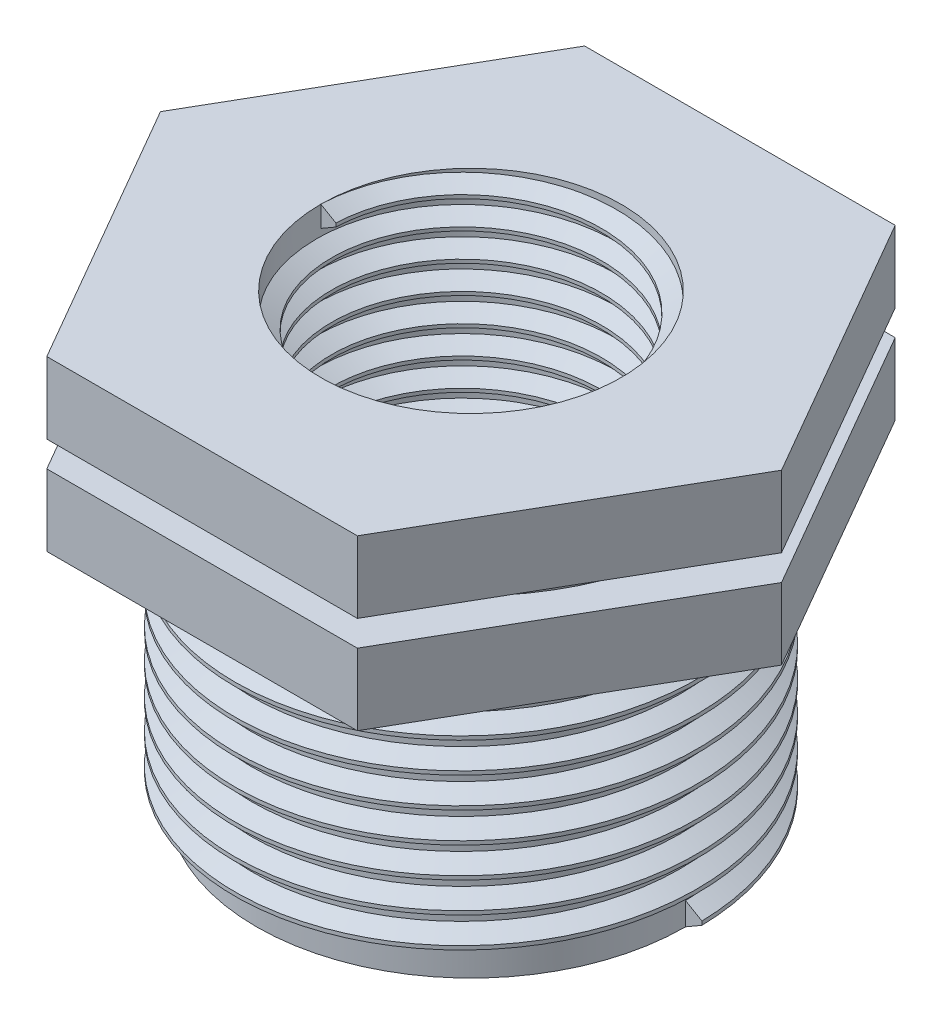
from build123d import *
from build123d.topology import SkipClean

# Parameters (mm, degrees)
SZKIC1_R                    = 15
SZKIC1_R_2                  = 11.5
DODANIE_WYCI_GNI_CIE1_DEPTH = 19.2
SZKIC2_R                    = 11.5
DODANIE_WYCI_GNI_CIE2_DEPTH = 11.8
DODANIE_WYCI_GNI_CIE3_START = -17
SZKIC3_R                    = 11.5
SZKIC3_R_2                  = 10.5
DODANIE_WYCI_GNI_CIE3_DEPTH = 17
DODANIE_WYCI_GNI_CIE5_START = 3
SZKIC4_R                    = 11.5
SZKIC4_R_2                  = 8.6
DODANIE_WYCI_GNI_CIE5_DEPTH = 3
WYTNIJ_WYCI_GNI_CIE1_START  = -5
SZKIC5_R                    = 16.5
WYTNIJ_WYCI_GNI_CIE1_DEPTH  = 1.8
GWINT1_PITCH                = 2.116666667
GWINT2_PITCH                = 1.953846154


with BuildPart() as part:
    # Szkic1 → Dodanie-wyciągnięcie1 (new body)
    with BuildSketch(Plane(origin=(0, 0, 0), x_dir=(1, 0, 0), z_dir=(0, 1, 0))):
        with Locations(Location((0, 0, 0), (0, 0, 270))):
            Circle(SZKIC1_R)
        with Locations(Location((0, 0, 0), (0, 0, 270))):
            Circle(SZKIC1_R_2, mode=Mode.SUBTRACT)
    extrude(amount=DODANIE_WYCI_GNI_CIE1_DEPTH)

    # Szkic2 → Dodanie-wyciągnięcie2 (add)
    with BuildSketch(Plane(origin=(0, 19.2, 0), x_dir=(1, 0, 0), z_dir=(0, 1, 0))):
        Polygon((21.708370122, 0), (10.854185061, 18.8), (-10.854185061, 18.8), (-21.708370122, 0), (-10.854185061, -18.8), (10.854185061, -18.8), align=None)
        with Locations(Location((0, 0, 0), (0, 0, 270))):
            Circle(SZKIC2_R, mode=Mode.SUBTRACT)
    extrude(amount=DODANIE_WYCI_GNI_CIE2_DEPTH)

    # Szkic3 → Dodanie-wyciągnięcie3 (add)
    with BuildSketch(Plane(origin=(0, 31, 0), x_dir=(1, 0, 0), z_dir=(0, 1, 0)).offset(DODANIE_WYCI_GNI_CIE3_START)):
        with Locations(Location((0, 0, 0), (0, 0, 270))):
            Circle(SZKIC3_R)
        with Locations(Location((0, 0, 0), (0, 0, 270))):
            Circle(SZKIC3_R_2, mode=Mode.SUBTRACT)
    extrude(amount=DODANIE_WYCI_GNI_CIE3_DEPTH)

    # Szkic4 → Dodanie-wyciągnięcie5 (add)
    with BuildSketch(Plane.XZ.offset(-14).offset(DODANIE_WYCI_GNI_CIE5_START)):
        with Locations(Location((0, 0, 0), (0, 0, 270))):
            Circle(SZKIC4_R)
        with Locations(Location((0, 0, 0), (0, 0, 270))):
            Circle(SZKIC4_R_2, mode=Mode.SUBTRACT)
    extrude(amount=-DODANIE_WYCI_GNI_CIE5_DEPTH)

    # Szkic5 → Wytnij-wyciągnięcie1 (cut)
    with BuildSketch(Plane(origin=(0, 31, 0), x_dir=(1, 0, 0), z_dir=(0, 1, 0)).offset(WYTNIJ_WYCI_GNI_CIE1_START)):
        Polygon((-10.854185061, -18.8), (10.854185061, -18.8), (21.708370122, 0), (10.854185061, 18.8), (-10.854185061, 18.8), (-21.708370122, 0), align=None)
        with Locations(Location((0, 0, 0), (0, 0, 270))):
            Circle(SZKIC5_R, mode=Mode.SUBTRACT)
    extrude(amount=-WYTNIJ_WYCI_GNI_CIE1_DEPTH, mode=Mode.SUBTRACT)

    # Gwint1: the profile of Profil gwintu1 profile screwed along a right-hand helix of 9.070866 turns, 10 arcs to a turn; built about Z, then put on its axis
    with SkipClean():  # the faces are left unmerged after this step: merging them gives an invalid solid
        gwint1_z = Axis((0, 0, 0), (0, 0, 1))
        gwint1_corners = [(14.9997, 0, -0.000173205), (16.145679435, 0, 0.66145833), (16.145679435, 0, 0.926041664), (14.9997, 0, 1.587673199)]
        with BuildLine(mode=Mode.PRIVATE) as gwint1_profile:
            Line(gwint1_corners[0], gwint1_corners[1])
            Line(gwint1_corners[1], gwint1_corners[2])
            Line(gwint1_corners[2], gwint1_corners[3])
            Line(gwint1_corners[3], gwint1_corners[0])
        gwint1_cap = Face(gwint1_profile.wire())
        gwint1_turn_angles = [0, 18, 36, 54, 72, 90, 108, 126, 144, 162, 180, 198, 216, 234, 252, 270, 288, 306, 324, 342, 360]
        gwint1_turn_weights = [1, 0.9510565162951535, 1, 0.9510565162951535, 1, 0.9510565162951535, 1, 0.9510565162951535, 1, 0.9510565162951535, 1, 0.9510565162951535, 1, 0.9510565162951535, 1, 0.9510565162951535, 1, 0.9510565162951535, 1, 0.9510565162951535, 1]
        gwint1_turn_rails = [Edge.make_bspline([Vector(p[0], p[1], 0).rotate(gwint1_z, gwint1_turn_angles[k]) / gwint1_turn_weights[k] + Vector(0, 0, p[2] + GWINT1_PITCH * gwint1_turn_angles[k] / 360) for k in range(21)], [0, 0, 0, 1, 1, 2, 2, 3, 3, 4, 4, 5, 5, 6, 6, 7, 7, 8, 8, 9, 9, 10, 10, 10], 2, gwint1_turn_weights) for p in gwint1_corners]
        gwint1_turn_sides = [Face.make_surface_from_curves(gwint1_turn_rails[p[0]], gwint1_turn_rails[p[1]]) for p in [(0, 1), (1, 2), (2, 3), (3, 0)]]
        gwint1_last_angles = [3240, 3252.755905512, 3265.511811024]
        gwint1_last_weights = [1, 0.9753195679051615, 1]
        gwint1_last_rails = [Edge.make_bspline([Vector(p[0], p[1], 0).rotate(gwint1_z, gwint1_last_angles[k]) / gwint1_last_weights[k] + Vector(0, 0, p[2] + GWINT1_PITCH * gwint1_last_angles[k] / 360) for k in range(3)], [0, 0, 0, 1, 1, 1], 2, gwint1_last_weights) for p in gwint1_corners]
        gwint1_last_sides = [Face.make_surface_from_curves(gwint1_last_rails[p[0]], gwint1_last_rails[p[1]]) for p in [(0, 1), (1, 2), (2, 3), (3, 0)]]
        gwint1 = Plane(origin=(0, 0, 0), x_dir=(1, 0, 0), z_dir=(0, 1, 0)) * Solid(Shell([*[p.moved(Location((0, 0, GWINT1_PITCH * i))) for i in range(9) for p in gwint1_turn_sides], *gwint1_last_sides, gwint1_cap, gwint1_cap.rotate(gwint1_z, 3265.511811024).moved(Location((0, 0, GWINT1_PITCH * 3265.511811024 / 360)))]))
        add(gwint1)

    # Gwint2: the profile of Profil gwintu2 profile screwed along a right-hand helix of 8.700787 turns, 10 arcs to a turn; built about Z, then put on its axis
    with SkipClean():  # the faces are left unmerged after this step: merging them gives an invalid solid
        gwint2_z = Axis((0, 0, 0), (0, 0, 1))
        gwint2_corners = [(10.5003, 0, -0.000173205), (9.442449752, 0, 0.61057692), (9.442449752, 0, 0.85480769), (10.5003, 0, 1.465557815)]
        with BuildLine(mode=Mode.PRIVATE) as gwint2_profile:
            Line(gwint2_corners[0], gwint2_corners[1])
            Line(gwint2_corners[1], gwint2_corners[2])
            Line(gwint2_corners[2], gwint2_corners[3])
            Line(gwint2_corners[3], gwint2_corners[0])
        gwint2_cap = Face(gwint2_profile.wire())
        gwint2_turn_angles = [0, 18, 36, 54, 72, 90, 108, 126, 144, 162, 180, 198, 216, 234, 252, 270, 288, 306, 324, 342, 360]
        gwint2_turn_weights = [1, 0.9510565162951535, 1, 0.9510565162951535, 1, 0.9510565162951535, 1, 0.9510565162951535, 1, 0.9510565162951535, 1, 0.9510565162951535, 1, 0.9510565162951535, 1, 0.9510565162951535, 1, 0.9510565162951535, 1, 0.9510565162951535, 1]
        gwint2_turn_rails = [Edge.make_bspline([Vector(p[0], p[1], 0).rotate(gwint2_z, gwint2_turn_angles[k]) / gwint2_turn_weights[k] + Vector(0, 0, p[2] + GWINT2_PITCH * gwint2_turn_angles[k] / 360) for k in range(21)], [0, 0, 0, 1, 1, 2, 2, 3, 3, 4, 4, 5, 5, 6, 6, 7, 7, 8, 8, 9, 9, 10, 10, 10], 2, gwint2_turn_weights) for p in gwint2_corners]
        gwint2_turn_sides = [Face.make_surface_from_curves(gwint2_turn_rails[p[0]], gwint2_turn_rails[p[1]]) for p in [(0, 1), (1, 2), (2, 3), (3, 0)]]
        gwint2_last_angles = [2880, 2898, 2916, 2934, 2952, 2970, 2988, 3006, 3024, 3042, 3060, 3078, 3096, 3114, 3132, 3132.141732283, 3132.283464567]
        gwint2_last_weights = [1, 0.9510565162951535, 1, 0.9510565162951535, 1, 0.9510565162951535, 1, 0.9510565162951535, 1, 0.9510565162951535, 1, 0.9510565162951535, 1, 0.9510565162951535, 1, 0.9999969404180766, 1]
        gwint2_last_rails = [Edge.make_bspline([Vector(p[0], p[1], 0).rotate(gwint2_z, gwint2_last_angles[k]) / gwint2_last_weights[k] + Vector(0, 0, p[2] + GWINT2_PITCH * gwint2_last_angles[k] / 360) for k in range(17)], [0, 0, 0, 1, 1, 2, 2, 3, 3, 4, 4, 5, 5, 6, 6, 7, 7, 8, 8, 8], 2, gwint2_last_weights) for p in gwint2_corners]
        gwint2_last_sides = [Face.make_surface_from_curves(gwint2_last_rails[p[0]], gwint2_last_rails[p[1]]) for p in [(0, 1), (1, 2), (2, 3), (3, 0)]]
        gwint2 = Plane(origin=(0, 31, 0), x_dir=(-1, 0, 0), z_dir=(0, -1, 0)) * Solid(Shell([*[p.moved(Location((0, 0, GWINT2_PITCH * i))) for i in range(8) for p in gwint2_turn_sides], *gwint2_last_sides, gwint2_cap, gwint2_cap.rotate(gwint2_z, 3132.283464567).moved(Location((0, 0, GWINT2_PITCH * 3132.283464567 / 360)))]))
        add(gwint2)


solid = part.part
